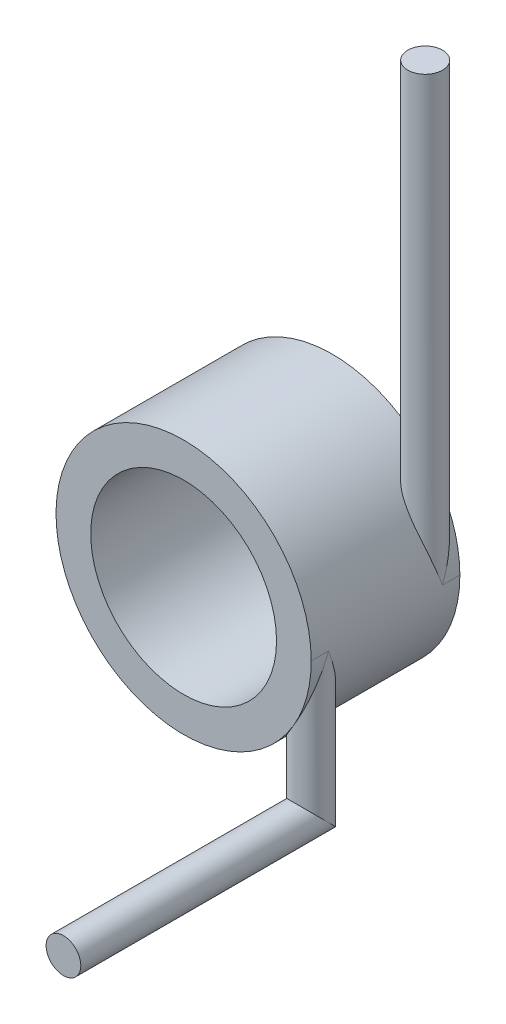
from build123d import *
from build123d.topology import SkipClean

# Parameters (mm, degrees)
SKETCH1_R           = 6.5405
SKETCH1_R_2         = 4.7625
BOSS_EXTRUDE1_DEPTH = 7.62
SKETCH2_R           = 0.889
BOSS_EXTRUDE2_DEPTH = 3.81
SKETCH2_3_R         = 0.889
BOSS_EXTRUDE3_DEPTH = 22.86
SKETCH11_R          = 0.889


with BuildPart() as part:
    # Sketch1 → Boss-Extrude1 (new body)
    with BuildSketch(Plane.XY):
        Circle(SKETCH1_R)
        Circle(SKETCH1_R_2, mode=Mode.SUBTRACT)
    extrude(amount=BOSS_EXTRUDE1_DEPTH)

    # Sketch2 → Boss-Extrude2 (add)
    with SkipClean():  # the faces are left unmerged after this step: merging them gives an invalid solid
        with BuildSketch(Plane(origin=(0, 0, 0), x_dir=(1, 0, 0), z_dir=(0, 1, 0))):
            with Locations((5.6515, -6.731)):
                Circle(SKETCH2_R)
        extrude(amount=-BOSS_EXTRUDE2_DEPTH)

    # Sketch2<3> → Boss-Extrude3 (add)
    with SkipClean():  # the faces are left unmerged after this step: merging them gives an invalid solid
        with BuildSketch(Plane(origin=(0, 0, 0), x_dir=(1, 0, 0), z_dir=(0, 1, 0))):
            with Locations((5.6515, -0.889)):
                Circle(SKETCH2_3_R)
        extrude(amount=BOSS_EXTRUDE3_DEPTH)

    # Sweep4: sweep along a path in Sketch10
    with SkipClean():  # the faces are left unmerged after this step: merging them gives an invalid solid
        with BuildLine(Plane(origin=(5.6515, 0, 0), x_dir=(0, 0, -1), z_dir=(1, 0, 0))) as sweep4_path:
            Line((-6.731, -3.81), (-6.731, -7.62))
            Line((-6.731, -7.62), (-19.431, -7.62))
        # Sketch11 → Sweep4 (sweep)
        with BuildSketch(Plane.XZ.offset(3.81)):
            with Locations((5.6515, 6.731)):
                Circle(SKETCH11_R)
        sweep(path=sweep4_path.line, transition=Transition.RIGHT)


solid = part.part
